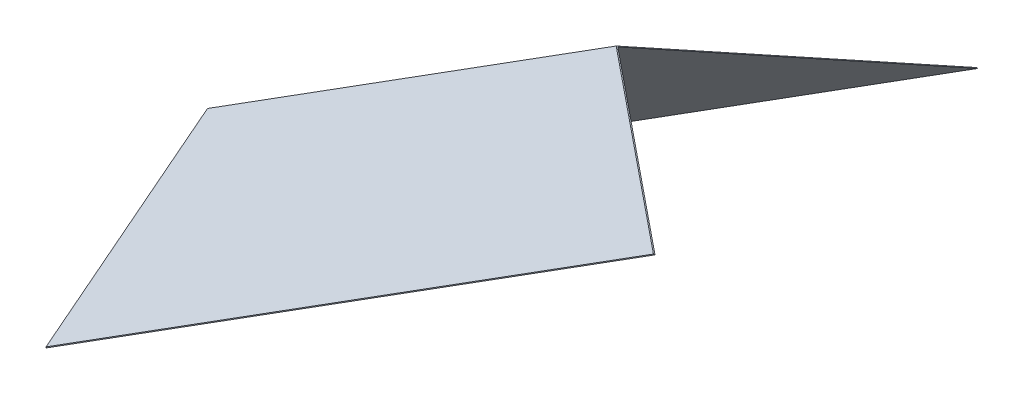
from build123d import *

# Parameters (mm, degrees)
SKETCH5_W          = 850.532199311
SKETCH5_H          = 887.458344
CUT_EXTRUDE5_DEPTH = 406.4


with BuildPart() as part:
    # Boss-Extrude1: read off the stored shape, not the designer's step
    # Boss-Extrude1: loft between two sections, ruled curve by curve
    boss_extrude1_from = [
        Edge.make_line((-86.167457674, 1821.517106037, 1121.25455637), (-492.567457674, 1821.517106037, 1451.45455637)),
        Edge.make_line((-492.567457674, 1821.517106037, 1451.45455637), (752.550801769, 2608.917106037, 1451.45455637)),
        Edge.make_line((752.550801769, 2608.917106037, 1451.45455637), (1158.950801769, 2608.917106037, 1121.25455637)),
        Edge.make_line((1158.950801769, 2608.917106037, 1121.25455637), (-86.167457674, 1821.517106037, 1121.25455637)),
    ]
    boss_extrude1_to = [
        Edge.make_line((-89.342457674, 1821.517106037, 1121.25455637), (-495.742457674, 1821.517106037, 1451.45455637)),
        Edge.make_line((-495.742457674, 1821.517106037, 1451.45455637), (749.375801769, 2608.917106037, 1451.45455637)),
        Edge.make_line((749.375801769, 2608.917106037, 1451.45455637), (1155.775801769, 2608.917106037, 1121.25455637)),
        Edge.make_line((1155.775801769, 2608.917106037, 1121.25455637), (-89.342457674, 1821.517106037, 1121.25455637)),
    ]
    boss_extrude1 = Solid(Shell([*[Face.make_surface_from_curves(boss_extrude1_from[k], boss_extrude1_to[k]) for k in range(4)], Face(Wire(boss_extrude1_from)), Face(Wire(boss_extrude1_to))]))
    add(boss_extrude1)

    # Mirror1: Boss-Extrude1 across plane
    add(boss_extrude1.mirror(Plane.XY.offset(1451.45455637)))

    # Sketch5 → Cut-Extrude5 (cut, symmetric)
    with BuildSketch(Plane(origin=(-492.567457674, 0, 0), x_dir=(0, 0, -1), z_dir=(1, 0, 0))):
        with Locations((-1421.298204875, 2221.371463485)):
            Rectangle(SKETCH5_W, SKETCH5_H)
    extrude(amount=CUT_EXTRUDE5_DEPTH, both=True, mode=Mode.SUBTRACT)


solid = part.part
